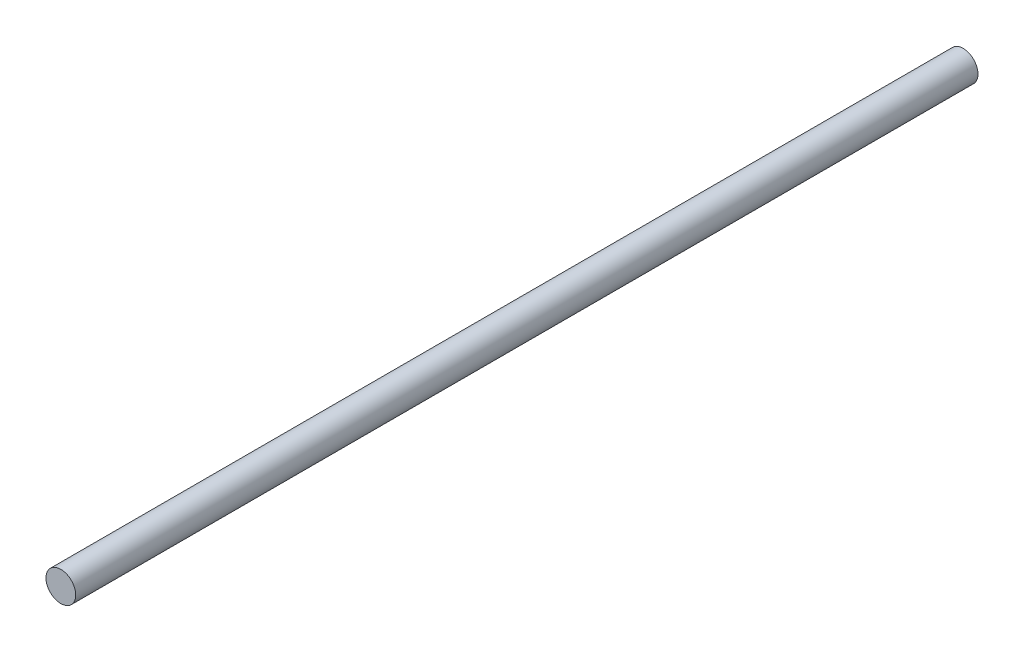
from build123d import *

# Parameters (mm, degrees)
SKETCH1_R           = 4
BOSS_EXTRUDE1_DEPTH = 243


with BuildPart() as part:
    # Sketch1 → Boss-Extrude1 (new body)
    with BuildSketch(Plane.XY):
        Circle(SKETCH1_R)
    extrude(amount=BOSS_EXTRUDE1_DEPTH)


solid = part.part
